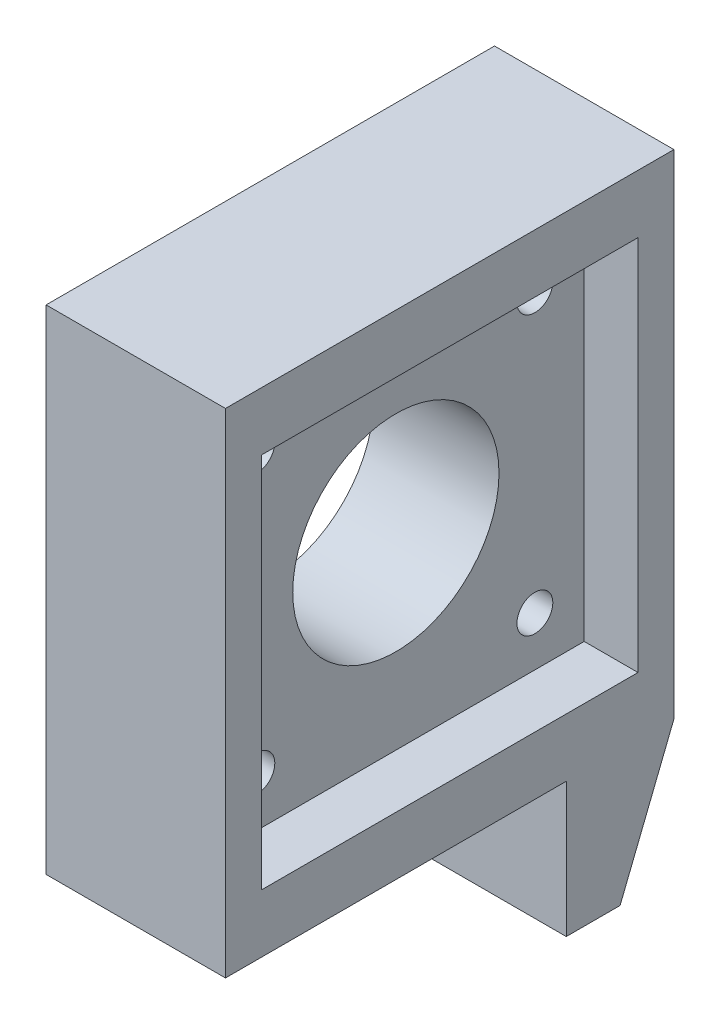
from build123d import *

# Parameters (mm, degrees)
SKETCH1_W           = 20
SKETCH1_H           = 50
BOSS_EXTRUDE1_DEPTH = 70
SKETCH2_R           = 2
SKETCH2_R_2         = 11.5
CUT_EXTRUDE2_DEPTH  = 60
SKETCH4_W           = 38
SKETCH4_H           = 15
CUT_EXTRUDE3_DEPTH  = 60
SKETCH8_R           = 2
CUT_EXTRUDE5_DEPTH  = 15
SKETCH9_W           = 42
SKETCH9_H           = 42
CUT_EXTRUDE6_DEPTH  = 6
SKETCH10_R          = 2
CUT_EXTRUDE7_DEPTH  = 7
CUT_EXTRUDE8_DEPTH  = 30


with BuildPart() as part:
    # Sketch1 → Boss-Extrude1 (new body)
    with BuildSketch(Plane(origin=(0, 0, 0), x_dir=(1, 0, 0), z_dir=(0, 1, 0))):
        with Locations((-10, -25)):
            Rectangle(SKETCH1_W, SKETCH1_H)
    extrude(amount=BOSS_EXTRUDE1_DEPTH)

    # Sketch2 → Cut-Extrude2 (cut)
    with BuildSketch(Plane(origin=(0, 0, 0), x_dir=(0, 0, -1), z_dir=(1, 0, 0))):
        with Locations((-9.5, 58)):
            Circle(SKETCH2_R)
        with Locations((-25, 42.5)):
            Circle(SKETCH2_R_2)
        with Locations((-9.5, 27)):
            Circle(SKETCH2_R)
        with Locations((-40.5, 27)):
            Circle(SKETCH2_R)
        with Locations((-40.5, 58)):
            Circle(SKETCH2_R)
    extrude(amount=-CUT_EXTRUDE2_DEPTH, mode=Mode.SUBTRACT)

    # Sketch4 → Cut-Extrude3 (cut)
    with BuildSketch(Plane(origin=(0, 0, 0), x_dir=(0, 0, -1), z_dir=(1, 0, 0))):
        with Locations((-31, 7.5)):
            Rectangle(SKETCH4_W, SKETCH4_H)
    extrude(amount=-CUT_EXTRUDE3_DEPTH, mode=Mode.SUBTRACT)

    # Sketch8 → Cut-Extrude5 (cut)
    with BuildSketch(Plane(origin=(0, 0, 0), x_dir=(-1, 0, 0), z_dir=(0, 0, -1))):
        with Locations((15, 6)):
            Circle(SKETCH8_R)
    extrude(amount=-CUT_EXTRUDE5_DEPTH, mode=Mode.SUBTRACT)

    # Sketch9 → Cut-Extrude6 (cut)
    with BuildSketch(Plane(origin=(0, 0, 0), x_dir=(0, 0, -1), z_dir=(1, 0, 0))):
        with Locations((-25, 42.5)):
            Rectangle(SKETCH9_W, SKETCH9_H)
    extrude(amount=-CUT_EXTRUDE6_DEPTH, mode=Mode.SUBTRACT)

    # Sketch10 → Cut-Extrude7 (cut)
    with BuildSketch(Plane(origin=(0, 0, 0), x_dir=(-1, 0, 0), z_dir=(0, 0, -1))):
        with Locations((5, 6)):
            Circle(SKETCH10_R)
    extrude(amount=-CUT_EXTRUDE7_DEPTH, mode=Mode.SUBTRACT)

    # Sketch11 → Cut-Extrude8 (cut)
    with BuildSketch(Plane(origin=(0, 0, 0), x_dir=(0, 0, -1), z_dir=(1, 0, 0))):
        Polygon((-6, 0), (0, 0), (0, 15), align=None)
    extrude(amount=-CUT_EXTRUDE8_DEPTH, mode=Mode.SUBTRACT)


solid = part.part
